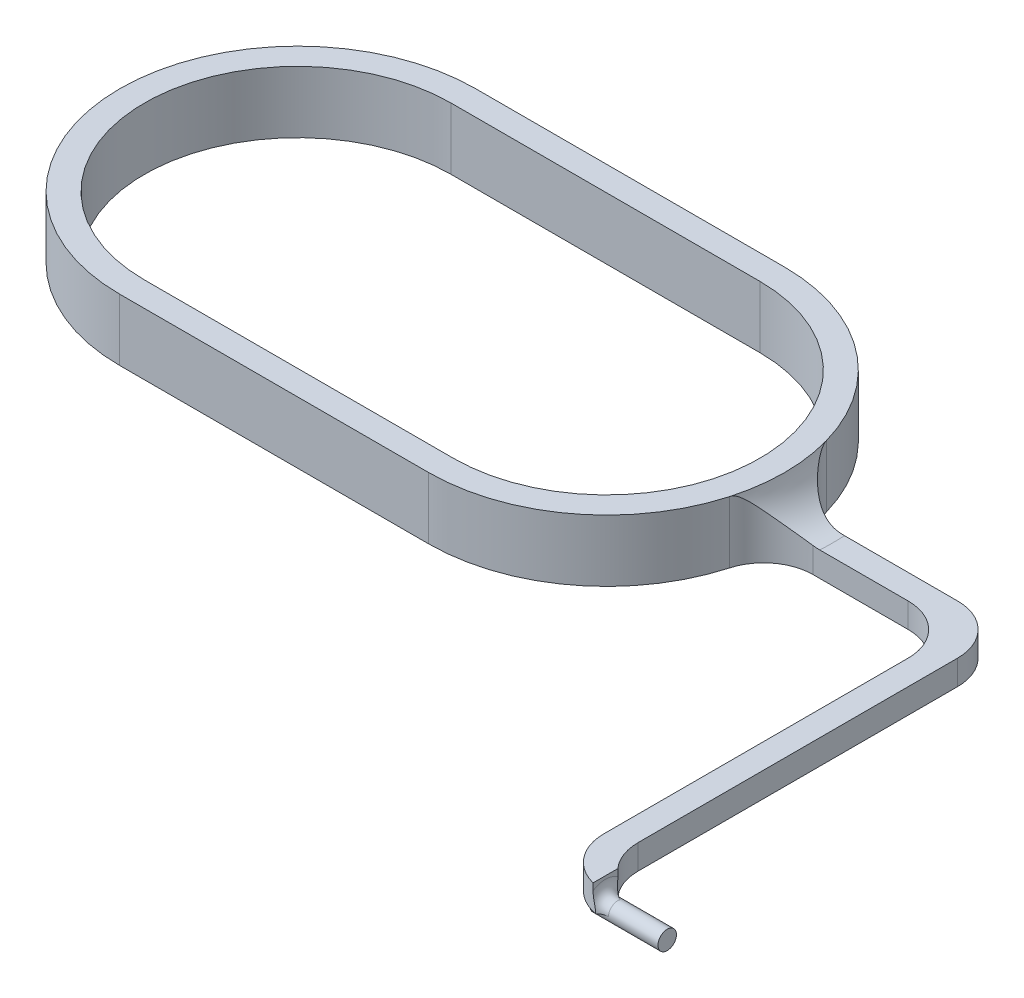
from build123d import *

# Parameters (mm, degrees)
BOSS_EXTRUDE1_DEPTH      = 5
SKETCH2_W                = 1
SKETCH2_H                = 2
SKETCH2_W_2              = 2
SKETCH2_H_2              = 30.5
BOSS_EXTRUDE2_DEPTH      = 2
FILLET1_R                = 4
BOSS_EXTRUDE3_DEPTH      = 5
BOSS_EXTRUDE3_DEPTH_BACK = 0.5
SKETCH3_R                = 0.75
FILLET3_R                = 1


with BuildPart() as part:
    # Sketch1 → Boss-Extrude1 (new body)
    with BuildSketch(Plane(origin=(0, 0, 0), x_dir=(1, 0, 0), z_dir=(0, 1, 0))):
        with BuildLine():
            Line((0, 14.4), (25, 14.4))
            ThreePointArc((25, 14.4), (39.4, 0), (25, -14.4))
            Line((25, -14.4), (0, -14.4))
            ThreePointArc((0, -14.4), (-14.4, 0), (0, 14.4))
        make_face()
        with BuildLine():
            Line((0, 12.4), (25, 12.4))
            ThreePointArc((25, 12.4), (37.4, 0), (25, -12.4))
            Line((25, -12.4), (0, -12.4))
            ThreePointArc((0, -12.4), (-12.4, 0), (0, 12.4))
        make_face(mode=Mode.SUBTRACT)
    extrude(amount=BOSS_EXTRUDE1_DEPTH)

    # Sketch2 → Boss-Extrude2 (add)
    with BuildSketch(Plane.XZ):
        with Locations((56.9, 32.5)):
            Rectangle(SKETCH2_W, SKETCH2_H)
        with Locations((55.4, 32.5)):
            Rectangle(SKETCH2_W_2, SKETCH2_H)
        with Locations((55.4, 16.25)):
            Rectangle(SKETCH2_W_2, SKETCH2_H_2)
        with BuildLine():
            Line((39.365235814, -1), (54.4, -1))
            Line((54.4, -1), (54.4, 1))
            Line((54.4, 1), (39.365235814, 1))
            ThreePointArc((39.365235814, 1), (39.4, 0), (39.365235814, -1))
        make_face()
        with Locations((55.4, 0)):
            Rectangle(SKETCH2_W_2, SKETCH2_H)
        with BuildLine():
            Line((37.4, -1), (39.365235814, -1))
            ThreePointArc((39.365235814, -1), (39.4, 0), (39.365235814, 1))
            Line((39.365235814, 1), (37.4, 1))
            Line((37.4, 1), (37.4, -1))
        make_face()
    extrude(amount=-BOSS_EXTRUDE2_DEPTH)

    # Fillet1
    # the kernel refuses this fillet: 4 mm, written as the material it adds along each edge
    with BuildSketch(Plane(origin=(25, 2, 0), x_dir=(0.7371891614816782, 0, -0.6756864214959037), z_dir=(-0.6756864214959037, 0, -0.7371891614816782))) as fillet1_piece_1_section:
        with BuildLine():
            CenterArc((18.272983346, -4), FILLET1_R, 90, 75.522487814)
            Line((18.272983346, 0), (18.272983346, 0.08))
            Line((18.272983346, 0.08), (14.4, 0.08))
            Line((14.4, 0.08), (14.32, 0))
            ThreePointArc((14.32, 0), (14.32, -1.5), (14.322540333, -2.98))
            Line((14.322540333, -2.98), (14.4, -3))
        make_face()
    fillet1_piece_1 = revolve(axis=Axis((25, 2, 0), (0, -1, 0)), revolution_arc=85.014954966, mode=Mode.PRIVATE)
    fillet1_piece_1 = split(fillet1_piece_1, bisect_by=Plane(origin=(40.301586348, 2.758397987, -1), z_dir=(0, 0, 1)), keep=Keep.TOP, mode=Mode.PRIVATE)
    fillet1_piece_1 = split(fillet1_piece_1, bisect_by=Plane(origin=(40.301586348, 2.758397987, 1), z_dir=(0, 0, -1)), keep=Keep.TOP, mode=Mode.PRIVATE)
    add(fillet1_piece_1)
    with BuildSketch(Plane(origin=(39.365235814, 2, 1), x_dir=(-0.17149804582148107, 0, 0.9851844600273663), z_dir=(0, -1, 0))) as fillet1_piece_2:
        with BuildLine():
            CenterArc((3.367524545, -3.978862537), FILLET1_R, 95.892851455, 74.232218513)
            Line((-0.573213295, -3.292870354), (-0.652028052, -3.27915051))
            Line((-0.652028052, -3.27915051), (-0.078814757, 0.013719844))
            Line((-0.078814757, 0.013719844), (0.008213474, 0.079577251))
            ThreePointArc((0.008213474, 0.079577251), (1.47842541, 0.003905135), (2.948637345, 0.079577251))
            Line((2.948637345, 0.079577251), (2.95685082, 0))
        make_face()
    extrude(amount=2)
    with BuildSketch(Plane(origin=(39.365235814, 2, -1), x_dir=(-0.17149804582148342, 0, -0.9851844600273658), z_dir=(0, -1, 0))) as fillet1_piece_3:
        with BuildLine():
            CenterArc((3.367524545, 3.978862537), FILLET1_R, 189.874930032, 74.232218513)
            Line((-0.573213295, 3.292870354), (-0.652028052, 3.27915051))
            Line((-0.652028052, 3.27915051), (-0.078814757, -0.013719844))
            Line((-0.078814757, -0.013719844), (0.008213474, -0.079577251))
            ThreePointArc((0.008213474, -0.079577251), (1.47842541, -0.003905135), (2.948637345, -0.079577251))
            Line((2.948637345, -0.079577251), (2.95685082, 0))
        make_face()
    extrude(amount=2)
    with BuildSketch(Plane(origin=(54.4, 0, 1), x_dir=(-1, 0, 0), z_dir=(0, 1, 0))) as fillet1_piece_4:
        with BuildLine():
            CenterArc((FILLET1_R, FILLET1_R), FILLET1_R, 180, 90)
            Line((0, FILLET1_R), (-FILLET1_R * 0.02, FILLET1_R))
            Line((-FILLET1_R * 0.02, FILLET1_R), (-FILLET1_R * 0.02, -FILLET1_R * 0.02))
            Line((-FILLET1_R * 0.02, -FILLET1_R * 0.02), (FILLET1_R, -FILLET1_R * 0.02))
            Line((FILLET1_R, -FILLET1_R * 0.02), (FILLET1_R, 0))
        make_face()
    extrude(amount=2)
    with BuildSketch(Plane(origin=(56.4, 0, 31.5), x_dir=(0, 0, -1), z_dir=(0, 1, 0))) as fillet1_piece_5:
        with BuildLine():
            CenterArc((2.645751311, -4), FILLET1_R, 90, 41.409622109)
            Line((0, -1), (-0.052915026, -0.94))
            ThreePointArc((-0.052915026, -0.94), (-0.08, -0.5), (-0.08, 0))
            Line((-0.08, 0), (0, 0.08))
            Line((0, 0.08), (2.645751311, 0.08))
            Line((2.645751311, 0.08), (2.645751311, 0))
        make_face()
    extrude(amount=2)
    with BuildSketch(Plane(origin=(39.365235814, 10.355974154, -1), x_dir=(-0.1714980458214834, 0, -0.9851844600273658), z_dir=(0, -1, 0))) as fillet1_piece_6a_section:
        with BuildLine():
            CenterArc((3.367524545, 3.978862537), FILLET1_R, 189.874930032, 74.232218513)
            Line((-0.573213295, 3.292870354), (-0.652028052, 3.27915051))
            Line((-0.652028052, 3.27915051), (-0.078814757, -0.013719844))
            Line((-0.078814757, -0.013719844), (0.008213474, -0.079577251))
            ThreePointArc((0.008213474, -0.079577251), (1.47842541, -0.003905135), (2.948637345, -0.079577251))
            Line((2.948637345, -0.079577251), (2.95685082, 0))
        make_face()
    fillet1_piece_6a = extrude(amount=10.355974154, mode=Mode.PRIVATE)
    fillet1_piece_6a = split(fillet1_piece_6a, bisect_by=Plane(origin=(40.057221624, 5, -1.646357347), z_dir=(0, -1, 0)), keep=Keep.TOP, mode=Mode.PRIVATE)
    fillet1_piece_6a = split(fillet1_piece_6a, bisect_by=Plane(origin=(40.057221624, 2, -1.646357347), z_dir=(0, 1, 0)), keep=Keep.TOP, mode=Mode.PRIVATE)
    with BuildSketch(Plane(origin=(25, 2, 0), x_dir=(0.7371891614816782, 0, -0.6756864214959037), z_dir=(-0.6756864214959037, 0, -0.7371891614816782))) as fillet1_piece_6b_section:
        with BuildLine():
            CenterArc((18.272983346, -4), FILLET1_R, 90, 75.522487814)
            Line((18.272983346, 0), (18.272983346, 0.08))
            Line((18.272983346, 0.08), (14.4, 0.08))
            Line((14.4, 0.08), (14.32, 0))
            ThreePointArc((14.32, 0), (14.32, -1.5), (14.322540333, -2.98))
            Line((14.322540333, -2.98), (14.4, -3))
        make_face()
    fillet1_piece_6b = revolve(axis=Axis((25, 2, 0), (0, -1, 0)), revolution_arc=85.014954966, mode=Mode.PRIVATE)
    fillet1_piece_6b = split(fillet1_piece_6b, bisect_by=Plane(origin=(38.861424428, 2.733448244, -1), z_dir=(0, 0, -1)), keep=Keep.TOP, mode=Mode.PRIVATE)
    fillet1_piece_6 = fillet1_piece_6a & fillet1_piece_6b
    add(fillet1_piece_6)
    with BuildSketch(Plane(origin=(25, 2, 0), x_dir=(0.7371891614816782, 0, -0.6756864214959037), z_dir=(-0.6756864214959037, 0, -0.7371891614816782))) as fillet1_piece_7a_section:
        with BuildLine():
            CenterArc((18.272983346, -4), FILLET1_R, 90, 75.522487814)
            Line((18.272983346, 0), (18.272983346, 0.08))
            Line((18.272983346, 0.08), (14.4, 0.08))
            Line((14.4, 0.08), (14.32, 0))
            ThreePointArc((14.32, 0), (14.32, -1.5), (14.322540333, -2.98))
            Line((14.322540333, -2.98), (14.4, -3))
        make_face()
    fillet1_piece_7a = revolve(axis=Axis((25, 2, 0), (0, -1, 0)), revolution_arc=85.014954966, mode=Mode.PRIVATE)
    fillet1_piece_7a = split(fillet1_piece_7a, bisect_by=Plane(origin=(38.861423807, 2.733448455, 1), z_dir=(0, 0, 1)), keep=Keep.TOP, mode=Mode.PRIVATE)
    with BuildSketch(Plane(origin=(39.365235814, 10.355974154, 1), x_dir=(-0.17149804582148107, 0, 0.9851844600273663), z_dir=(0, -1, 0))) as fillet1_piece_7b_section:
        with BuildLine():
            CenterArc((3.367524545, -3.978862537), FILLET1_R, 95.892851455, 74.232218513)
            Line((-0.573213295, -3.292870354), (-0.652028052, -3.27915051))
            Line((-0.652028052, -3.27915051), (-0.078814757, 0.013719844))
            Line((-0.078814757, 0.013719844), (0.008213474, 0.079577251))
            ThreePointArc((0.008213474, 0.079577251), (1.47842541, 0.003905135), (2.948637345, 0.079577251))
            Line((2.948637345, 0.079577251), (2.95685082, 0))
        make_face()
    fillet1_piece_7b = extrude(amount=10.355974154, mode=Mode.PRIVATE)
    fillet1_piece_7b = split(fillet1_piece_7b, bisect_by=Plane(origin=(40.057221624, 5, 1.646357347), z_dir=(0, -1, 0)), keep=Keep.TOP, mode=Mode.PRIVATE)
    fillet1_piece_7b = split(fillet1_piece_7b, bisect_by=Plane(origin=(40.057221624, 2, 1.646357347), z_dir=(0, 1, 0)), keep=Keep.TOP, mode=Mode.PRIVATE)
    fillet1_piece_7 = fillet1_piece_7a & fillet1_piece_7b
    add(fillet1_piece_7)
    # the kernel refuses this fillet: 4 mm, written as the material it takes off along each edge
    with BuildSketch(Plane(origin=(56.4, -10, -1), x_dir=(-1, 0, 0), z_dir=(0, 1, 0))) as fillet1_2_piece_1:
        with BuildLine():
            CenterArc((FILLET1_R, FILLET1_R), FILLET1_R, 180, 90)
            Line((0, FILLET1_R), (-FILLET1_R * 0.02, FILLET1_R))
            Line((-FILLET1_R * 0.02, FILLET1_R), (-FILLET1_R * 0.02, -FILLET1_R * 0.02))
            Line((-FILLET1_R * 0.02, -FILLET1_R * 0.02), (FILLET1_R, -FILLET1_R * 0.02))
            Line((FILLET1_R, -FILLET1_R * 0.02), (FILLET1_R, 0))
        make_face()
    extrude(amount=22, mode=Mode.SUBTRACT)
    with BuildSketch(Plane(origin=(54.4, -9.682458366, 33.5), x_dir=(1, 0, 0), z_dir=(0, 1, 0))) as fillet1_2_piece_2:
        with BuildLine():
            CenterArc((4, 3.872983346), FILLET1_R, 180, 75.522487814)
            Line((0, 3.872983346), (-0.08, 3.872983346))
            Line((-0.08, 3.872983346), (-0.08, 0))
            Line((-0.08, 0), (0, -0.08))
            ThreePointArc((0, -0.08), (1.5, -0.08), (2.98, -0.077459667))
            Line((2.98, -0.077459667), (3, 0))
        make_face()
    extrude(amount=21.364916731, mode=Mode.SUBTRACT)

    # Sketch3 → Boss-Extrude3 (add, two sides: drawn at the far end of the back side and taken through both)
    with BuildSketch(Plane(origin=(57.4, 0, 0), x_dir=(0, 0, -1), z_dir=(1, 0, 0)).offset(-BOSS_EXTRUDE3_DEPTH_BACK)):
        with Locations((-32.5, 0)):
            Circle(SKETCH3_R)
    extrude(amount=BOSS_EXTRUDE3_DEPTH + BOSS_EXTRUDE3_DEPTH_BACK)

    # Fillet3
    # the kernel refuses this fillet: 1 mm, written as the material it adds along each edge
    with BuildSketch(Plane(origin=(57.4, 0, 32.5), x_dir=(0, 0, -1), z_dir=(0, -1, 0))) as fillet3_piece_1_section:
        with BuildLine():
            CenterArc((0.75 + FILLET3_R, FILLET3_R), FILLET3_R, 180, 90)
            Line((0.75, FILLET3_R), (0.75, 0))
            Line((0.75, 0), (0.75 + FILLET3_R, 0))
        make_face()
    fillet3_piece_1 = revolve(axis=Axis((57.4, 0, 32.5), (1, 0, 0)), revolution_arc=180, mode=Mode.PRIVATE)
    fillet3_piece_1 = fillet3_piece_1 & Plane(origin=(58.4, 0.745327828, 29.627016654), x_dir=(1, 0, 0), z_dir=(0, -1, 0)) * Cylinder(4, 7, mode=Mode.PRIVATE)
    fillet3_piece_1 = fillet3_piece_1 - Plane(origin=(60.4, 0.745327828, 28.854248689), x_dir=(0, 0, -1), z_dir=(0, -1, 0)) * Cylinder(4, 7, mode=Mode.PRIVATE)
    add(fillet3_piece_1)


solid = part.part
